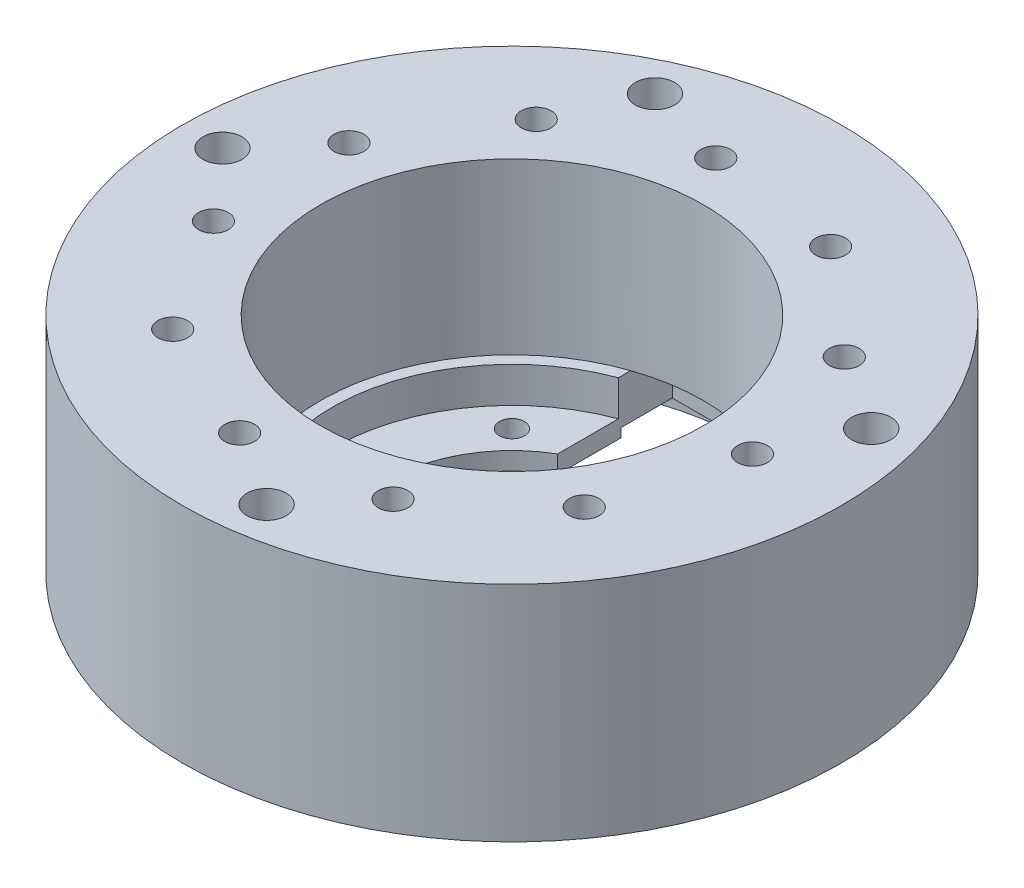
from build123d import *

# Parameters (mm, degrees)
SKETCH1_R           = 37
BOSS_EXTRUDE1_DEPTH = 25.05
SKETCH2_R           = 21.5
CUT_EXTRUDE1_DEPTH  = 19.05
SKETCH3_R           = 20.2
CUT_EXTRUDE2_DEPTH  = 4
SKETCH4_R           = 14
CUT_EXTRUDE3_DEPTH  = 58.177814754
SKETCH5_W           = 14
SKETCH5_H           = 14
CUT_EXTRUDE4_DEPTH  = 6
SKETCH6_R           = 1.4
CUT_EXTRUDE5_DEPTH  = 59.01295114
SKETCH7_R           = 1.675
CUT_EXTRUDE6_DEPTH  = 4.75
SKETCH8_R           = 2.2
CUT_EXTRUDE7_DEPTH  = 5.5
SKETCH9_R           = 26
SKETCH9_R_2         = 20.5
CUT_EXTRUDE8_DEPTH  = 1
SKETCH11_R          = 2.2
CUT_EXTRUDE9_DEPTH  = 5.5
CIRPATTERN1_COUNT   = 4


with BuildPart() as part:
    # Sketch1 → Boss-Extrude1 (new body)
    with BuildSketch(Plane(origin=(0, 0, 0), x_dir=(1, 0, 0), z_dir=(0, 1, 0))):
        Circle(SKETCH1_R)
    extrude(amount=BOSS_EXTRUDE1_DEPTH)

    # Sketch2 → Cut-Extrude1 (cut)
    with BuildSketch(Plane(origin=(0, 25.05, 0), x_dir=(1, 0, 0), z_dir=(0, 1, 0))):
        Circle(SKETCH2_R)
    extrude(amount=-CUT_EXTRUDE1_DEPTH, mode=Mode.SUBTRACT)

    # Sketch3 → Cut-Extrude2 (cut)
    with BuildSketch(Plane(origin=(0, 6, 0), x_dir=(1, 0, 0), z_dir=(0, 1, 0))):
        Circle(SKETCH3_R)
    extrude(amount=-CUT_EXTRUDE2_DEPTH, mode=Mode.SUBTRACT)

    # Sketch4 → Cut-Extrude3 (cut, through all)
    with BuildSketch(Plane(origin=(0, 2, 0), x_dir=(1, 0, 0), z_dir=(0, 1, 0))):
        Circle(SKETCH4_R)
    extrude(amount=-CUT_EXTRUDE3_DEPTH, mode=Mode.SUBTRACT)

    # Sketch5 → Cut-Extrude4 (cut)
    with BuildSketch(Plane(origin=(0, 0, 0), x_dir=(1, 0, 0), z_dir=(0, 1, 0))):
        with Locations((0, 18)):
            Rectangle(SKETCH5_W, SKETCH5_H)
    extrude(amount=CUT_EXTRUDE4_DEPTH, mode=Mode.SUBTRACT)

    # Sketch6 → Cut-Extrude5 (cut, through all)
    with BuildSketch(Plane(origin=(0, 0, 0), x_dir=(1, 0, 0), z_dir=(0, 1, 0))):
        with Locations((12.021, 12.021)):
            Circle(SKETCH6_R)
        with Locations((12.021, -12.021)):
            Circle(SKETCH6_R)
        with Locations((-12.021, -12.021)):
            Circle(SKETCH6_R)
        with Locations((-12.021, 12.021)):
            Circle(SKETCH6_R)
    extrude(amount=CUT_EXTRUDE5_DEPTH, mode=Mode.SUBTRACT)

    # Sketch7 → Cut-Extrude6 (cut)
    with BuildSketch(Plane(origin=(0, 25.05, 0), x_dir=(1, 0, 0), z_dir=(0, 1, 0))):
        with Locations((27, 0)):
            Circle(SKETCH7_R)
        with Locations((22.713845386, -14.597302071)):
            Circle(SKETCH7_R)
        with Locations((11.216205351, -24.560063875)):
            Circle(SKETCH7_R)
        with Locations((-3.842500633, -26.725178931)):
            Circle(SKETCH7_R)
        with Locations((-17.681239817, -20.405238508)):
            Circle(SKETCH7_R)
        with Locations((-25.906310288, -7.606779035)):
            Circle(SKETCH7_R)
        with Locations((-25.906310288, 7.606779035)):
            Circle(SKETCH7_R)
        with Locations((-17.681239817, 20.405238508)):
            Circle(SKETCH7_R)
        with Locations((-3.842500633, 26.725178931)):
            Circle(SKETCH7_R)
        with Locations((11.216205351, 24.560063875)):
            Circle(SKETCH7_R)
        with Locations((22.713845386, 14.597302071)):
            Circle(SKETCH7_R)
    extrude(amount=-CUT_EXTRUDE6_DEPTH, mode=Mode.SUBTRACT)

    # Sketch8 → Cut-Extrude7 (cut)
    with BuildSketch(Plane(origin=(0, 25.05, 0), x_dir=(1, 0, 0), z_dir=(0, 1, 0))):
        with Locations((31.184102699, 9.154328969)):
            Circle(SKETCH8_R)
        with Locations((-13.503333209, 29.56196868)):
            Circle(SKETCH8_R)
        with Locations((-32.5, 0)):
            Circle(SKETCH8_R)
        with Locations((4.624211408, -32.169343619)):
            Circle(SKETCH8_R)
    extrude(amount=-CUT_EXTRUDE7_DEPTH, mode=Mode.SUBTRACT)

    # Sketch9 → Cut-Extrude8 (cut)
    with BuildSketch(Plane(origin=(0, 0, 0), x_dir=(1, 0, 0), z_dir=(0, 1, 0))):
        Circle(SKETCH9_R)
        Circle(SKETCH9_R_2, mode=Mode.SUBTRACT)
    extrude(amount=CUT_EXTRUDE8_DEPTH, mode=Mode.SUBTRACT)

    # Sketch11 → Cut-Extrude9 (cut)
    with BuildSketch(Plane.XZ):
        with Locations((21.920310217, 21.920310217)):
            Circle(SKETCH11_R)
    cut_extrude9 = extrude(amount=-CUT_EXTRUDE9_DEPTH, mode=Mode.SUBTRACT)

    # CirPattern1: Cut-Extrude9 ×4 about axis
    cirpattern1_axis = Axis((0, 25.05, 0), (0, -1, 0))
    for i in range(1, CIRPATTERN1_COUNT):
        add(cut_extrude9.rotate(cirpattern1_axis, i * 360 / CIRPATTERN1_COUNT), mode=Mode.SUBTRACT)


solid = part.part
